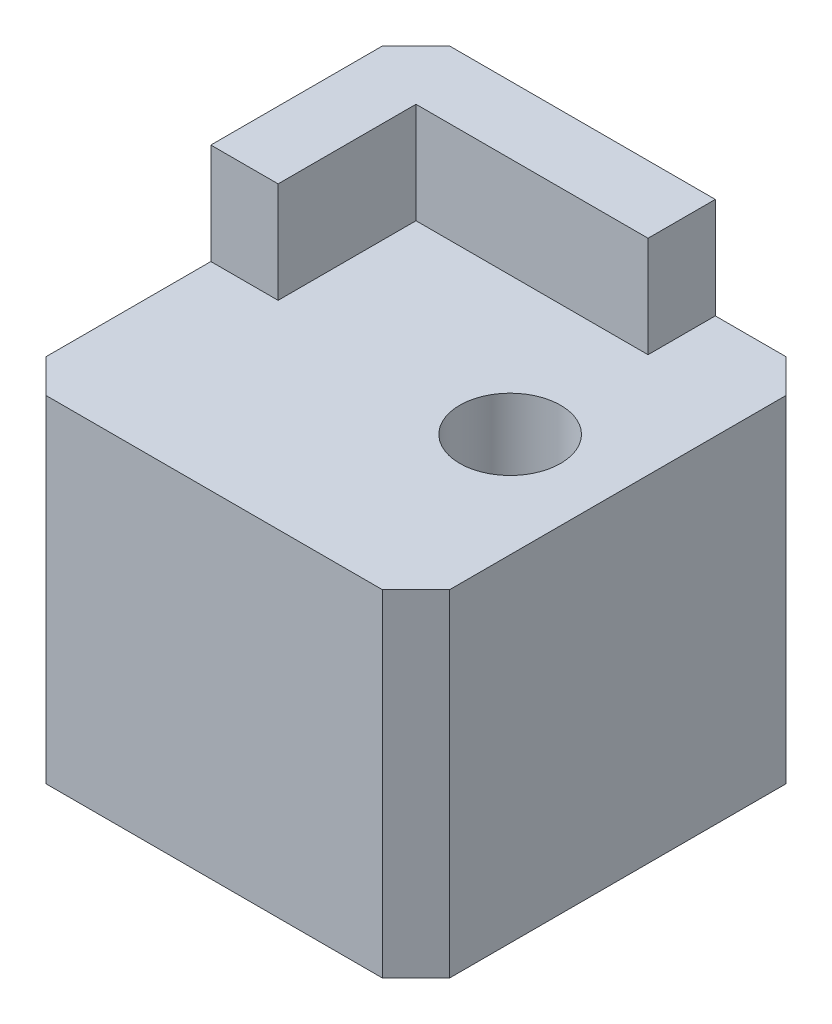
from build123d import *

# Parameters (mm, degrees)
SKETCH1_W           = 12
SKETCH1_H           = 12
BOSS_EXTRUDE1_DEPTH = 10
BOSS_EXTRUDE2_DEPTH = 3
CHAMFER1_SIZE       = 1
SKETCH1_4_R         = 1.5
CUT_EXTRUDE1_DEPTH  = 15.711220208


with BuildPart() as part:
    # Sketch1 → Boss-Extrude1 (new body)
    with BuildSketch(Plane(origin=(0, 0, 0), x_dir=(1, 0, 0), z_dir=(0, 1, 0))):
        with Locations((-2.9, 0.1)):
            Rectangle(SKETCH1_W, SKETCH1_H)
    extrude(amount=-BOSS_EXTRUDE1_DEPTH)

    # Sketch1<3> → Boss-Extrude2 (add)
    with BuildSketch(Plane(origin=(0, 0, 0), x_dir=(1, 0, 0), z_dir=(0, 1, 0))):
        Polygon((-6.9, 4.1), (0, 4.1), (0, 6.1), (-8.9, 6.1), (-8.9, 0), (-6.9, 0), align=None)
    extrude(amount=BOSS_EXTRUDE2_DEPTH)

    # Chamfer1
    chamfer1_edges = [part.edges().sort_by_distance(p)[0] for p in [
        (-8.9, -3.5, -6.1),
        (3.1, -5, -6.1),
        (-8.9, -5, 5.9),
        (3.1, -5, 5.9),
    ]]
    chamfer(chamfer1_edges, length=CHAMFER1_SIZE)

    # Sketch1<4> → Cut-Extrude1 (cut, through all)
    with BuildSketch(Plane(origin=(0, 0, 0), x_dir=(1, 0, 0), z_dir=(0, 1, 0))):
        Circle(SKETCH1_4_R)
    extrude(amount=-CUT_EXTRUDE1_DEPTH, mode=Mode.SUBTRACT)


solid = part.part
